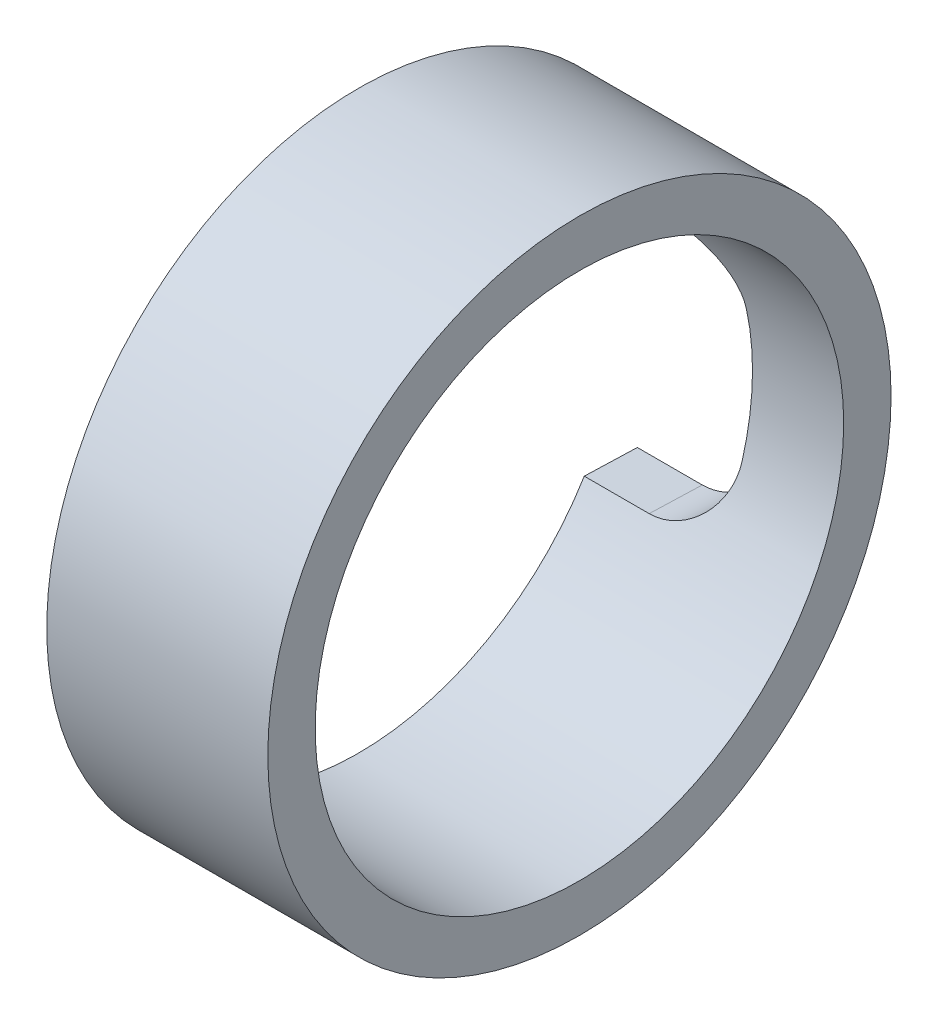
from build123d import *

# Parameters (mm, degrees)
SKETCH1_W          = 6.485999982
SKETCH1_H          = 1.390000014
CUT_EXTRUDE1_REACH = 43.1


with BuildPart() as part:
    # Sketch1 → Revolve1 (revolve)
    with BuildSketch(Plane.XY):
        with Locations((-35.769999961, 8.448999993)):
            Rectangle(SKETCH1_W, SKETCH1_H)
    revolve(axis=Axis((0, 0, 0), (-1, 0, 0)))

    # Sketch3 → Cut-Extrude1 (cut, up to next)
    with BuildSketch(Plane(origin=(0, 0, 0), x_dir=(1, 0, 0), z_dir=(0, -0.03230281229794067, -0.9994781279836212)), mode=Mode.PRIVATE) as cut_extrude1_sk1:
        with BuildLine():
            Line((-39.012999952, 3.81), (-39.012999952, -3.81))
            Line((-39.012999952, -3.81), (-37.107999952, -3.81))
            ThreePointArc((-37.107999952, -3.81), (-35.760961534, -3.252038418), (-35.202999952, -1.905))
            Line((-35.202999952, -1.905), (-35.202999952, 1.905))
            ThreePointArc((-35.202999952, 1.905), (-35.760961534, 3.252038418), (-37.107999952, 3.81))
            Line((-37.107999952, 3.81), (-39.012999952, 3.81))
        make_face()
    cut_extrude1_tool1 = extrude(cut_extrude1_sk1.sketch, amount=CUT_EXTRUDE1_REACH, mode=Mode.PRIVATE) & part.part
    add(cut_extrude1_tool1.solids().sort_by_distance((-37.191875, 0, 0))[0], mode=Mode.SUBTRACT)


solid = part.part
